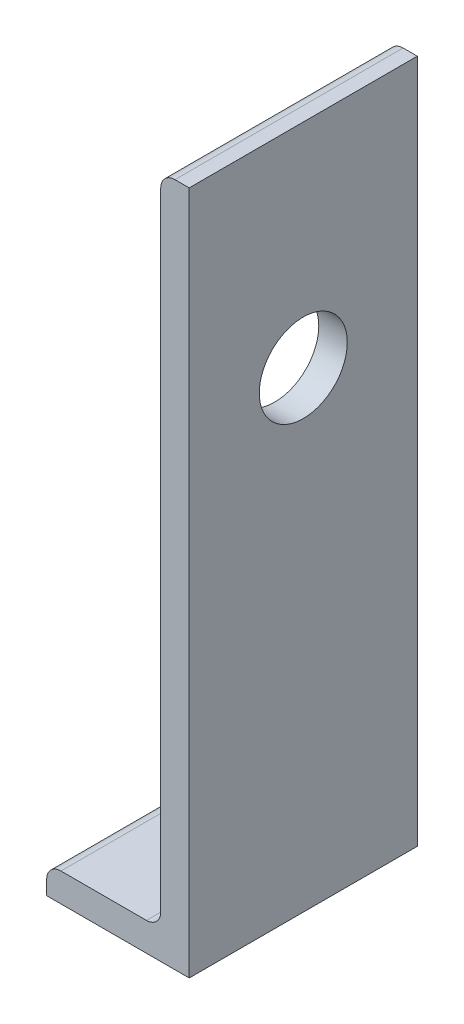
from build123d import *

# Parameters (mm, degrees)
BOSS_EXTRUDE1_DEPTH = 25.4
SKETCH3_R           = 4.765
CUT_EXTRUDE1_DEPTH  = 156.31560007
SKETCH5_R           = 9.8
CUT_EXTRUDE2_DEPTH  = 12.7


with BuildPart() as part:
    # Sketch2 → Boss-Extrude1 (new, symmetric)
    with BuildSketch(Plane.XY):
        with BuildLine():
            Line((-15.875, 0), (15.875, 0))
            Line((15.875, 0), (15.875, 152.4))
            Line((15.875, 152.4), (12.7, 152.4))
            ThreePointArc((12.7, 152.4), (10.45493597, 151.47006403), (9.525, 149.225))
            Line((9.525, 149.225), (9.525, 9.525))
            ThreePointArc((9.525, 9.525), (8.59506403, 7.27993597), (6.35, 6.35))
            Line((6.35, 6.35), (-12.7, 6.35))
            ThreePointArc((-12.7, 6.35), (-14.94506403, 5.42006403), (-15.875, 3.175))
            Line((-15.875, 3.175), (-15.875, 0))
        make_face()
    extrude(amount=BOSS_EXTRUDE1_DEPTH, both=True)

    # Sketch3 → Cut-Extrude1 (cut, through all)
    with BuildSketch(Plane.XZ):
        with Locations((-4.826, 0)):
            Circle(SKETCH3_R)
    extrude(amount=-CUT_EXTRUDE1_DEPTH, mode=Mode.SUBTRACT)

    # Sketch5 → Cut-Extrude2 (cut)
    with BuildSketch(Plane(origin=(15.875, 0, 0), x_dir=(0, 0, -1), z_dir=(1, 0, 0))):
        with Locations((0, 105)):
            Circle(SKETCH5_R)
    extrude(amount=-CUT_EXTRUDE2_DEPTH, mode=Mode.SUBTRACT)


solid = part.part
